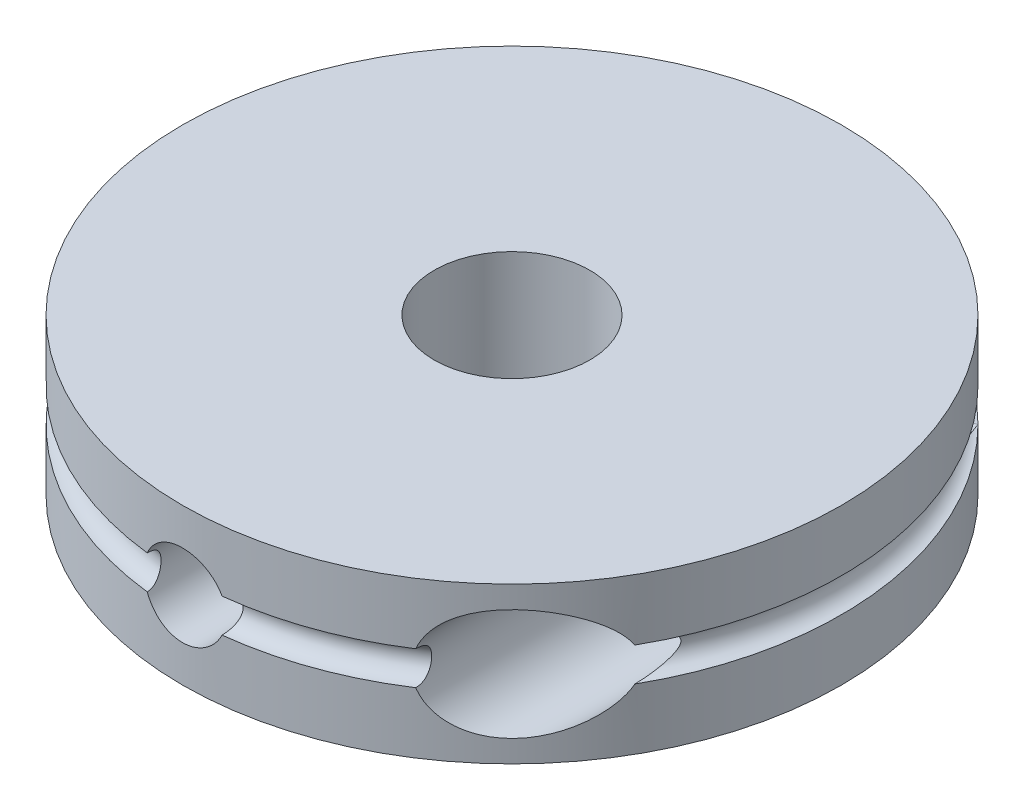
from build123d import *

# Parameters (mm, degrees)
BASE_R                  = 12.7
BASE_R_2                = 3
MAIN_BODY_DEPTH         = 6
SKETCH4_R               = 0.65
CUT_EXTRUDE2_REACH      = 20.936
SKETCH5_R               = 1.58115
CUT_EXTRUDE3_DEPTH      = 19.936208869
CUT_EXTRUDE3_DEPTH_BACK = 19.936208869
SKETCH8_R               = 0.65
SKETCH9_R               = 2.15
CUT_EXTRUDE4_DEPTH      = 19.936208869


with BuildPart() as part:
    # BASE → MAIN_BODY (new body)
    with BuildSketch(Plane(origin=(0, 0, 0), x_dir=(1, 0, 0), z_dir=(0, 1, 0))):
        Circle(BASE_R)
        Circle(BASE_R_2, mode=Mode.SUBTRACT)
    extrude(amount=MAIN_BODY_DEPTH)

    # Sketch4 → CABLE_GUIDE (revolve, cut)
    with BuildSketch(Plane.XY):
        with Locations((12.7, 3)):
            Circle(SKETCH4_R)
    revolve(axis=Axis((0, 0, 0), (0, 1, 0)), mode=Mode.SUBTRACT)

    # Sketch5 → Cut-Extrude2 (cut, up to next)
    with BuildSketch(Plane.XY, mode=Mode.PRIVATE) as cut_extrude2_sk1:
        with Locations((0, 3)):
            Circle(SKETCH5_R)
    cut_extrude2_tool1 = extrude(cut_extrude2_sk1.sketch, amount=CUT_EXTRUDE2_REACH, mode=Mode.PRIVATE) & part.part
    add(cut_extrude2_tool1.solids().sort_by_distance((0, 3, 0))[0], mode=Mode.SUBTRACT)

    # Sketch8 → Cut-Extrude3 (cut, two sides: drawn at the far end of the back side and taken through both)
    with BuildSketch(Plane.XY.offset(-CUT_EXTRUDE3_DEPTH_BACK)):
        with Locations((8.98025612, 3)):
            Circle(SKETCH8_R)
    extrude(amount=CUT_EXTRUDE3_DEPTH + CUT_EXTRUDE3_DEPTH_BACK, mode=Mode.SUBTRACT)

    # Sketch9 → Cut-Extrude4 (cut, through all)
    with BuildSketch(Plane.XY):
        with Locations((8.98025612, 3)):
            Circle(SKETCH9_R)
    extrude(amount=CUT_EXTRUDE4_DEPTH, mode=Mode.SUBTRACT)


solid = part.part
